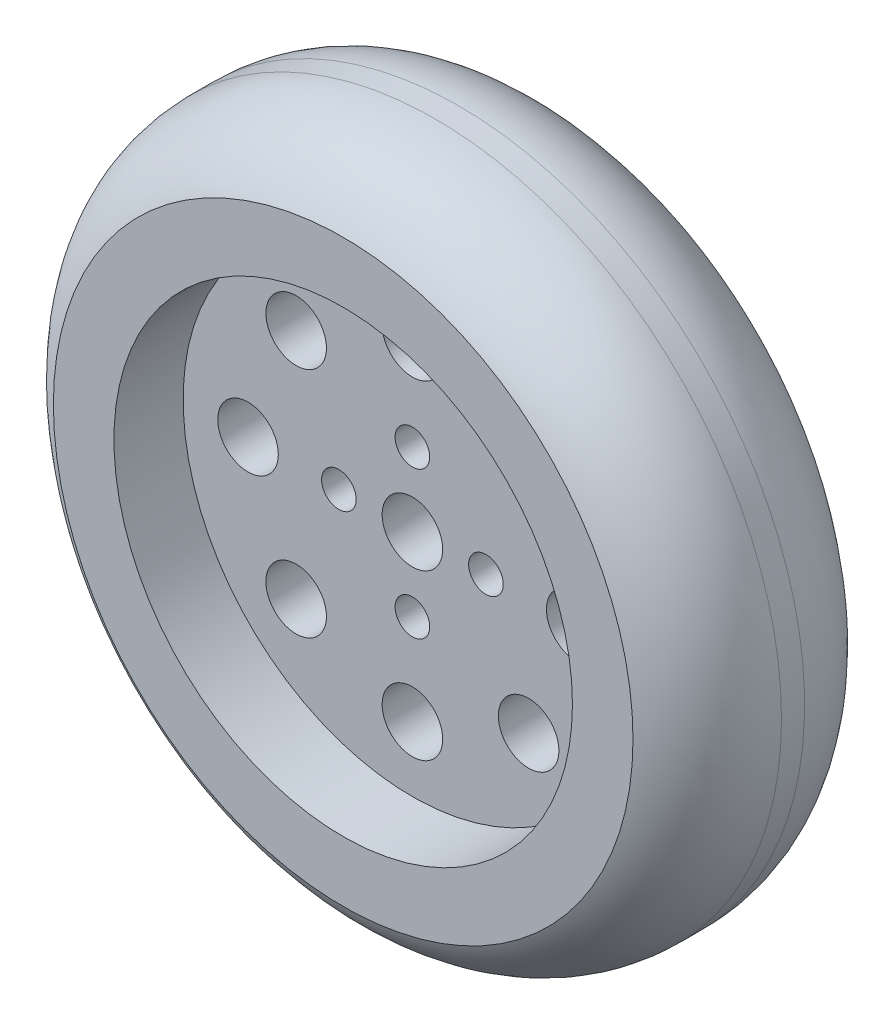
from build123d import *

# Parameters (mm, degrees)
ESQUISSE1_R             = 40
BOSS_EXTRU_1_DEPTH      = 24
ESQUISSE6_R             = 33.5
ENL_V_MAT_EXTRU_5_DEPTH = 8
ENL_V_START             = -8
ESQUISSE3_R             = 33.5
ENL_V_MAT_EXTRU_6_DEPTH = 8
CONG_12_R               = 12
CONG_16_R               = 12
ESQUISSE11_R            = 33.5
ESQUISSE11_R_2          = 26.5
BOSS_EXTRU_3_DEPTH      = 8
BOSS_EXTRU_4_START      = 8
ESQUISSE13_R            = 33.5
ESQUISSE13_R_2          = 26.5
BOSS_EXTRU_4_DEPTH      = 8
ESQUISSE14_R            = 3.5
ESQUISSE14_R_2          = 2
ENL_V_MAT_EXTRU_7_DEPTH = 59.787753827


with BuildPart() as part:
    # Esquisse1 → Boss.-Extru.1 (new body)
    with BuildSketch(Plane.XY):
        Circle(ESQUISSE1_R)
    extrude(amount=BOSS_EXTRU_1_DEPTH)

    # Esquisse6 → Enlèv. mat.-Extru.5 (cut)
    with BuildSketch(Plane(origin=(0, 0, 0), x_dir=(-1, 0, 0), z_dir=(0, 0, -1))):
        Circle(ESQUISSE6_R)
    extrude(amount=-ENL_V_MAT_EXTRU_5_DEPTH, mode=Mode.SUBTRACT)

    # Esquisse3 → Enlèv. mat.-Extru.6 (cut)
    with BuildSketch(Plane.XY.offset(24).offset(ENL_V_START)):
        with Locations(Location((0, 0, 0), (0, 0, 180))):
            Circle(ESQUISSE3_R)
    extrude(amount=ENL_V_MAT_EXTRU_6_DEPTH, mode=Mode.SUBTRACT)

    # Congé12
    # the kernel refuses this fillet: 12 mm, written as the material it takes off along each edge
    with BuildSketch(Plane(origin=(0, 0, 0), x_dir=(1, 0, 0), z_dir=(0, -1, 0))) as cong_12_piece_1:
        with BuildLine():
            CenterArc((28, 10.665364504), CONG_12_R, 297.279612736, 62.720387264)
            Line((33.5, 0), (33.61, -0.21330729))
            ThreePointArc((33.61, -0.21330729), (36.75, -0.24), (40, -0.24))
            Line((40, -0.24), (40.24, 0))
            Line((40.24, 0), (40.24, 10.665364504))
            Line((40.24, 10.665364504), (40, 10.665364504))
        make_face()
    revolve(axis=Axis((0, 0, 0), (0, 0, 1)), mode=Mode.SUBTRACT)

    # Congé16
    # the kernel refuses this fillet: 12 mm, written as the material it takes off along each edge
    with BuildSketch(Plane(origin=(0, 0, 24), x_dir=(1, 0, 0), z_dir=(0, -1, 0))) as cong_16_piece_1:
        with BuildLine():
            CenterArc((28, -10.665364504), CONG_16_R, 0, 62.720387264)
            Line((33.5, 0), (33.61, 0.21330729))
            ThreePointArc((33.61, 0.21330729), (36.75, 0.24), (40, 0.24))
            Line((40, 0.24), (40.24, 0))
            Line((40.24, 0), (40.24, -10.665364504))
            Line((40.24, -10.665364504), (40, -10.665364504))
        make_face()
    revolve(axis=Axis((0, 0, 24), (0, 0, 1)), mode=Mode.SUBTRACT)

    # Esquisse11 → Boss.-Extru.3 (add)
    with BuildSketch(Plane.XY.offset(16)):
        with Locations(Location((0, 0, 0), (0, 0, 180))):
            Circle(ESQUISSE11_R)
        Circle(ESQUISSE11_R_2, mode=Mode.SUBTRACT)
    extrude(amount=BOSS_EXTRU_3_DEPTH)

    # Esquisse13 → Boss.-Extru.4 (add)
    with BuildSketch(Plane(origin=(0, 0, 8), x_dir=(-1, 0, 0), z_dir=(0, 0, -1)).offset(BOSS_EXTRU_4_START)):
        Circle(ESQUISSE13_R)
        with Locations(Location((0, 0, 0), (0, 0, 180))):
            Circle(ESQUISSE13_R_2, mode=Mode.SUBTRACT)
    extrude(amount=-BOSS_EXTRU_4_DEPTH)

    # Esquisse14 → Enlèv. mat.-Extru.7 (cut, through all)
    with BuildSketch(Plane(origin=(0, 0, 8), x_dir=(-1, 0, 0), z_dir=(0, 0, -1))):
        Circle(ESQUISSE14_R)
        with Locations((-8.5, 0)):
            Circle(ESQUISSE14_R_2)
        with Locations((-19, 0)):
            Circle(ESQUISSE14_R)
        with Locations((0, 8.5)):
            Circle(ESQUISSE14_R_2)
        with Locations((8.5, 0)):
            Circle(ESQUISSE14_R_2)
        with Locations((0, -8.5)):
            Circle(ESQUISSE14_R_2)
        with Locations((-13.435028843, 13.435028843)):
            Circle(ESQUISSE14_R)
        with Locations((0, 19)):
            Circle(ESQUISSE14_R)
        with Locations((13.435028843, 13.435028843)):
            Circle(ESQUISSE14_R)
        with Locations((19, 0)):
            Circle(ESQUISSE14_R)
        with Locations((13.435028843, -13.435028843)):
            Circle(ESQUISSE14_R)
        with Locations((0, -19)):
            Circle(ESQUISSE14_R)
        with Locations((-13.435028843, -13.435028843)):
            Circle(ESQUISSE14_R)
    extrude(amount=-ENL_V_MAT_EXTRU_7_DEPTH, mode=Mode.SUBTRACT)


solid = part.part
